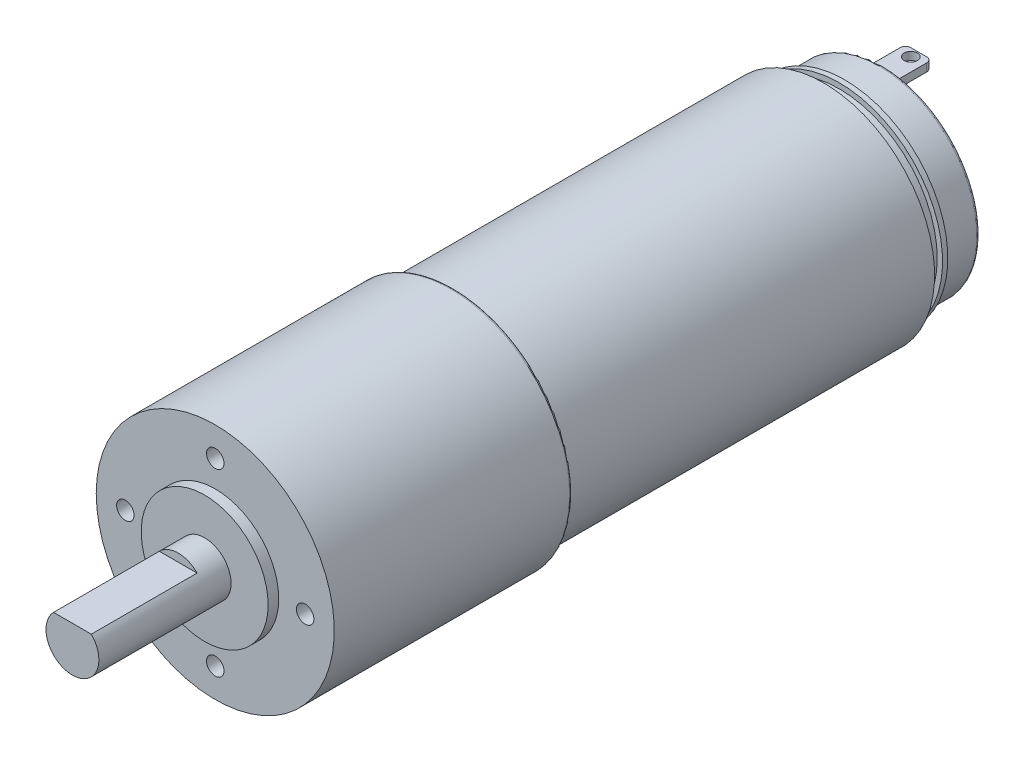
from build123d import *

# Parameters (mm, degrees)
SKETCH2_R             = 22.5
BOSS_EXTRUDE2_DEPTH   = 45
M4_TAPPED_HOLE2_D     = 3.3
M4_TAPPED_HOLE2_DEPTH = 10.1
M4_TAPPED_HOLE2_TIP   = 0.991420021
SKETCH6_R             = 12
BOSS_EXTRUDE3_DEPTH   = 2
SKETCH7_R             = 5
BOSS_EXTRUDE4_DEPTH   = 25
CUT_EXTRUDE1_START    = -20
CUT_EXTRUDE1_DEPTH    = 20
SKETCH9_R             = 21
BOSS_EXTRUDE5_DEPTH   = 70
SKETCH10_R            = 18.5
BOSS_EXTRUDE6_DEPTH   = 3
SKETCH11_R            = 19.5
BOSS_EXTRUDE7_DEPTH   = 1
SKETCH12_R            = 18.5
BOSS_EXTRUDE8_DEPTH   = 7
SKETCH13_W            = 5
SKETCH13_H            = 1.5
BOSS_EXTRUDE9_DEPTH   = 7
SKETCH14_R            = 1.25
CUT_EXTRUDE2_DEPTH    = 100.047968177
FILLET1_R             = 1
FILLET2_R             = 0.5
FILLET3_R             = 0.5


with BuildPart() as part:
    # Sketch2 → Boss-Extrude2 (new body)
    with BuildSketch(Plane.XY):
        Circle(SKETCH2_R)
    extrude(amount=BOSS_EXTRUDE2_DEPTH)

    # M4 Tapped Hole2
    with Locations(Plane(origin=(0, 17, 45), x_dir=(1, 0, 0), z_dir=(0, 0, 1))):
        with Locations((0, 0), (17, -17), (0, -34), (-17, -17)):
            Hole(M4_TAPPED_HOLE2_D / 2, depth=M4_TAPPED_HOLE2_DEPTH)
            with Locations((0, 0, -(M4_TAPPED_HOLE2_DEPTH + M4_TAPPED_HOLE2_TIP / 2))):  # 118° drill point
                Cone(0, M4_TAPPED_HOLE2_D / 2, M4_TAPPED_HOLE2_TIP, mode=Mode.SUBTRACT)

    # Sketch6 → Boss-Extrude3 (add)
    with BuildSketch(Plane.XY.offset(45)):
        Circle(SKETCH6_R)
    extrude(amount=BOSS_EXTRUDE3_DEPTH)

    # Sketch7 → Boss-Extrude4 (add)
    with BuildSketch(Plane.XY.offset(47)):
        Circle(SKETCH7_R)
    extrude(amount=BOSS_EXTRUDE4_DEPTH)

    # Sketch8 → Cut-Extrude1 (cut)
    with BuildSketch(Plane.XY.offset(72).offset(CUT_EXTRUDE1_START)):
        with BuildLine():
            Line((-3.570714214, 3.5), (3.570714214, 3.5))
            ThreePointArc((3.570714214, 3.5), (0, 5), (-3.570714214, 3.5))
        make_face()
    extrude(amount=CUT_EXTRUDE1_DEPTH, mode=Mode.SUBTRACT)

    # Sketch9 → Boss-Extrude5 (add)
    with BuildSketch(Plane(origin=(0, 0, 0), x_dir=(-1, 0, 0), z_dir=(0, 0, -1))):
        Circle(SKETCH9_R)
    extrude(amount=BOSS_EXTRUDE5_DEPTH)

    # Sketch10 → Boss-Extrude6 (add)
    with BuildSketch(Plane(origin=(0, 0, -70), x_dir=(-1, 0, 0), z_dir=(0, 0, -1))):
        Circle(SKETCH10_R)
    extrude(amount=BOSS_EXTRUDE6_DEPTH)

    # Sketch11 → Boss-Extrude7 (add)
    with BuildSketch(Plane(origin=(0, 0, -73), x_dir=(-1, 0, 0), z_dir=(0, 0, -1))):
        Circle(SKETCH11_R)
    extrude(amount=BOSS_EXTRUDE7_DEPTH)

    # Sketch12 → Boss-Extrude8 (add)
    with BuildSketch(Plane(origin=(0, 0, -74), x_dir=(-1, 0, 0), z_dir=(0, 0, -1))):
        Circle(SKETCH12_R)
    extrude(amount=BOSS_EXTRUDE8_DEPTH)

    # Sketch13 → Boss-Extrude9 (add)
    with BuildSketch(Plane(origin=(0, 0, -81), x_dir=(-1, 0, 0), z_dir=(0, 0, -1))):
        with Locations((0, -16.25)):
            Rectangle(SKETCH13_W, SKETCH13_H)
        with Locations((0, 16.25)):
            Rectangle(SKETCH13_W, SKETCH13_H)
    extrude(amount=BOSS_EXTRUDE9_DEPTH)

    # Sketch14 → Cut-Extrude2 (cut, through all)
    with BuildSketch(Plane.XZ.offset(17)):
        with Locations((0, -86.5)):
            Circle(SKETCH14_R)
    extrude(amount=-CUT_EXTRUDE2_DEPTH, mode=Mode.SUBTRACT)

    # Fillet1
    fillet1_edges = [part.edges().sort_by_distance(p)[0] for p in [
        (2.5, 16.25, -88),
        (-2.5, 16.25, -88),
        (2.5, -16.25, -88),
        (-2.5, -16.25, -88),
    ]]
    fillet(fillet1_edges, radius=FILLET1_R)

    # Fillet2
    fillet2_edges = [part.edges().sort_by_distance(p)[0] for p in [
        (18.5, 0, -81),
    ]]
    fillet(fillet2_edges, radius=FILLET2_R)

    # Fillet3
    fillet3_edges = [part.edges().sort_by_distance(p)[0] for p in [
        (-22.5, 0, 0),
    ]]
    fillet(fillet3_edges, radius=FILLET3_R)


solid = part.part
